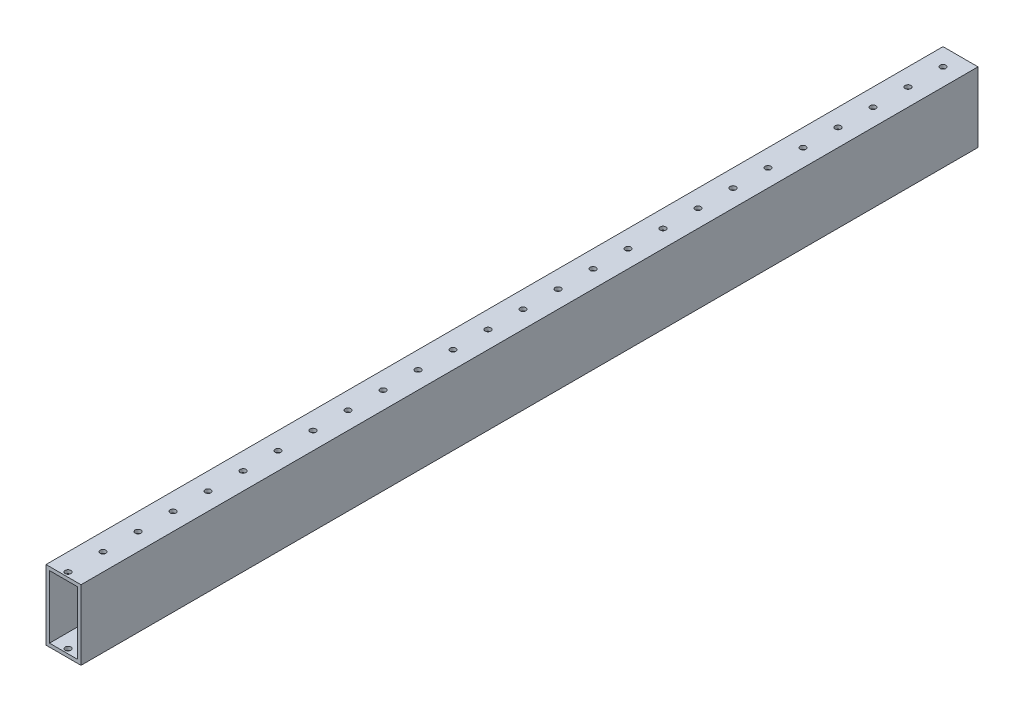
from build123d import *

# Parameters (mm, degrees)
CROQUIS1_W              = 25.4
CROQUIS1_H              = 50.7
CROQUIS1_W_2            = 20.32
CROQUIS1_H_2            = 45.62
SALIENTE_EXTRUIR1_DEPTH = 651
CROQUIS2_R              = 2.07
CORTAR_EXTRUIR2_DEPTH   = 54


with BuildPart() as part:
    # Croquis1 → Saliente-Extruir1 (new body)
    with BuildSketch(Plane.XY):
        Rectangle(CROQUIS1_W, CROQUIS1_H)
        Rectangle(CROQUIS1_W_2, CROQUIS1_H_2, mode=Mode.SUBTRACT)
    extrude(amount=SALIENTE_EXTRUIR1_DEPTH)

    # Croquis2 → Cortar-Extruir2 (cut)
    with BuildSketch(Plane(origin=(0, 25.35, 0), x_dir=(1, 0, 0), z_dir=(0, 1, 0))):
        with Locations((0, -12.7)):
            Circle(CROQUIS2_R)
        with Locations((0, -38.1)):
            Circle(CROQUIS2_R)
        with Locations((0, -63.5)):
            Circle(CROQUIS2_R)
        with Locations((0, -88.9)):
            Circle(CROQUIS2_R)
        with Locations((0, -114.3)):
            Circle(CROQUIS2_R)
        with Locations((0, -139.7)):
            Circle(CROQUIS2_R)
        with Locations((0, -165.1)):
            Circle(CROQUIS2_R)
        with Locations((0, -190.5)):
            Circle(CROQUIS2_R)
        with Locations((0, -215.9)):
            Circle(CROQUIS2_R)
        with Locations((0, -241.3)):
            Circle(CROQUIS2_R)
        with Locations((0, -266.7)):
            Circle(CROQUIS2_R)
        with Locations((0, -292.1)):
            Circle(CROQUIS2_R)
        with Locations((0, -317.5)):
            Circle(CROQUIS2_R)
        with Locations((0, -342.9)):
            Circle(CROQUIS2_R)
        with Locations((0, -368.3)):
            Circle(CROQUIS2_R)
        with Locations((0, -393.7)):
            Circle(CROQUIS2_R)
        with Locations((0, -419.1)):
            Circle(CROQUIS2_R)
        with Locations((0, -444.5)):
            Circle(CROQUIS2_R)
        with Locations((0, -469.9)):
            Circle(CROQUIS2_R)
        with Locations((0, -495.3)):
            Circle(CROQUIS2_R)
        with Locations((0, -520.7)):
            Circle(CROQUIS2_R)
        with Locations((0, -546.1)):
            Circle(CROQUIS2_R)
        with Locations((0, -571.5)):
            Circle(CROQUIS2_R)
        with Locations((0, -596.9)):
            Circle(CROQUIS2_R)
        with Locations((0, -622.3)):
            Circle(CROQUIS2_R)
        with Locations((0, -647.7)):
            Circle(CROQUIS2_R)
    extrude(amount=-CORTAR_EXTRUIR2_DEPTH, mode=Mode.SUBTRACT)


solid = part.part
